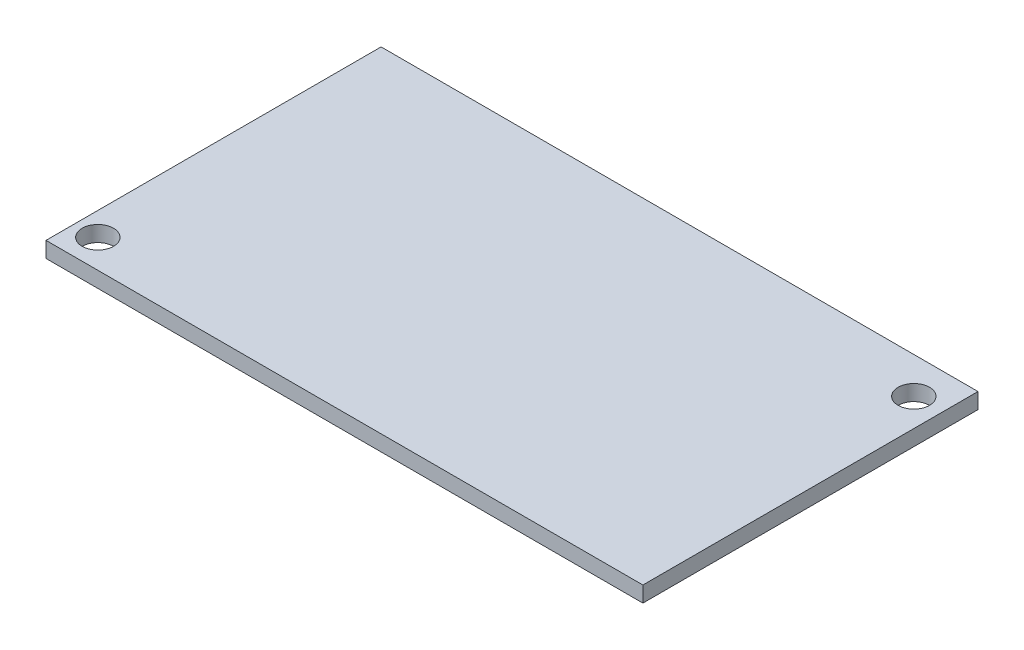
from build123d import *

# Parameters (mm, degrees)
SKETCH1_W           = 57
SKETCH1_H           = 32
BOSS_EXTRUDE1_DEPTH = 1.5
SKETCH2_R           = 1.5
CUT_EXTRUDE1_DEPTH  = 33.718496298


with BuildPart() as part:
    # Sketch1 → Boss-Extrude1 (new body)
    with BuildSketch(Plane(origin=(0, 0, 0), x_dir=(1, 0, 0), z_dir=(0, 1, 0))):
        Rectangle(SKETCH1_W, SKETCH1_H)
    extrude(amount=BOSS_EXTRUDE1_DEPTH)

    # Sketch2 → Cut-Extrude1 (cut, through all)
    with BuildSketch(Plane(origin=(0, 1.5, 0), x_dir=(1, 0, 0), z_dir=(0, 1, 0))):
        with Locations((-26.27957449, -13.270105415)):
            Circle(SKETCH2_R)
        with Locations((25.832110139, 12.537237645)):
            Circle(SKETCH2_R)
    extrude(amount=-CUT_EXTRUDE1_DEPTH, mode=Mode.SUBTRACT)


solid = part.part
